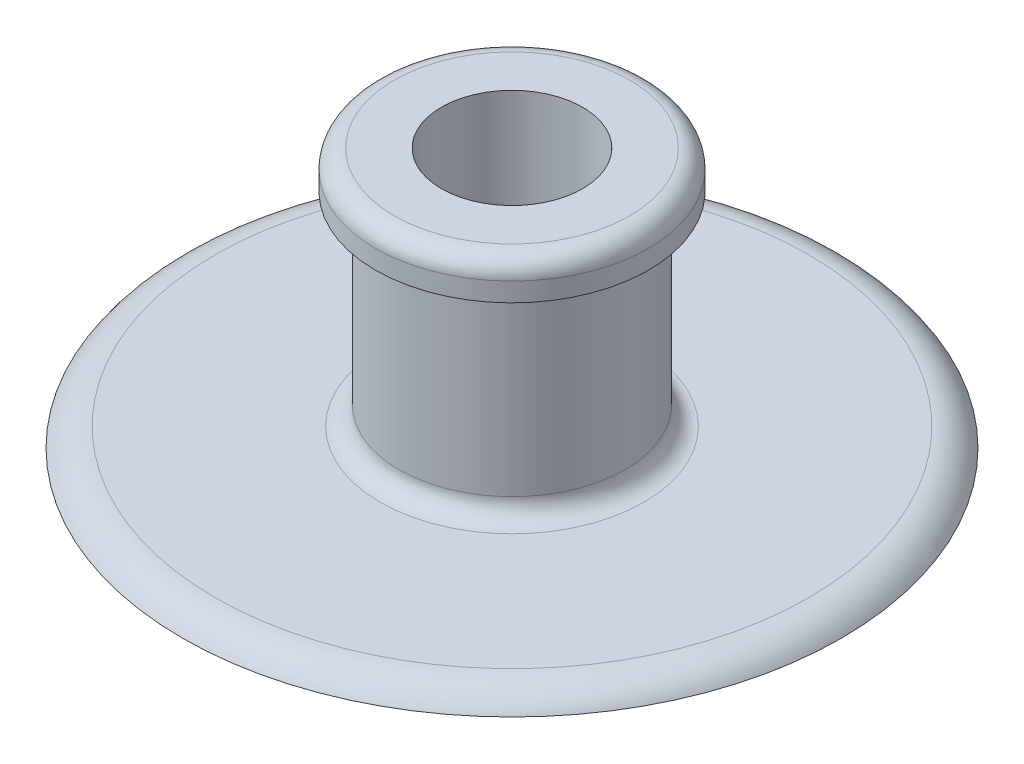
from build123d import *

# Parameters (mm, degrees)
SKETCH1_R           = 22.225
BOSS_EXTRUDE1_DEPTH = 1.27
SKETCH2_R           = 7.62
BOSS_EXTRUDE2_DEPTH = 16.256
SKETCH3_R           = 4.7625
CUT_EXTRUDE1_DEPTH  = 36.986968836
FILLET1_R           = 1.27
SKETCH4_R           = 0.508
CUT_EXTRUDE2_DEPTH  = 36.986968836
FILLET2_R           = 2.54
FILLET3_R           = 2.54
SKETCH5_W           = 1.5875
SKETCH5_H           = 2.54
FILLET4_R           = 1.27


with BuildPart() as part:
    # Sketch1 → Boss-Extrude1 (new body)
    with BuildSketch(Plane(origin=(0, 0, 0), x_dir=(1, 0, 0), z_dir=(0, 1, 0))):
        with Locations(Location((0, 0, 0), (0, 0, 270))):
            Circle(SKETCH1_R)
    extrude(amount=BOSS_EXTRUDE1_DEPTH)

    # Sketch2 → Boss-Extrude2 (add)
    with BuildSketch(Plane(origin=(0, 1.27, 0), x_dir=(1, 0, 0), z_dir=(0, 1, 0))):
        with Locations(Location((0, 0, 0), (0, 0, 270))):
            Circle(SKETCH2_R)
    extrude(amount=BOSS_EXTRUDE2_DEPTH)

    # Sketch3 → Cut-Extrude1 (cut, through all)
    with BuildSketch(Plane(origin=(0, 17.526, 0), x_dir=(1, 0, 0), z_dir=(0, 1, 0))):
        with Locations(Location((0, 0, 0), (0, 0, 270))):
            Circle(SKETCH3_R)
    extrude(amount=-CUT_EXTRUDE1_DEPTH, mode=Mode.SUBTRACT)

    # Fillet1
    fillet1_edges = [part.edges().sort_by_distance(p)[0] for p in [
        (0, 1.27, -7.62),
    ]]
    fillet(fillet1_edges, radius=FILLET1_R)

    # Sketch4 → Cut-Extrude2 (cut, through all)
    with BuildSketch(Plane(origin=(0, 0, 0), x_dir=(0, 0, -1), z_dir=(1, 0, 0))):
        with Locations((0, 2.54)):
            Circle(SKETCH4_R)
    extrude(amount=-CUT_EXTRUDE2_DEPTH, mode=Mode.SUBTRACT)

    # Fillet2
    # the kernel refuses this fillet: 2.54 mm, written as the material it takes off along each edge
    with BuildSketch(Plane(origin=(0, 1.27, 0), x_dir=(0, 0, 1), z_dir=(-1, 0, 0))) as fillet2_piece_1:
        with BuildLine():
            CenterArc((20.025295474, -2.54), FILLET2_R, 30, 60)
            Line((22.225, -1.27), (22.268994091, -1.2446))
            ThreePointArc((22.268994091, -1.2446), (22.2758, -0.635), (22.2758, 0))
            Line((22.2758, 0), (22.225, 0.0508))
            Line((22.225, 0.0508), (20.025295474, 0.0508))
            Line((20.025295474, 0.0508), (20.025295474, 0))
        make_face()
    revolve(axis=Axis((0, 1.27, 0), (0, 1, 0)), mode=Mode.SUBTRACT)

    # Fillet3
    # the kernel refuses this fillet: 2.54 mm, written as the material it takes off along each edge
    with BuildSketch(Plane(origin=(0, 0, 0), x_dir=(0, 0, 1), z_dir=(-1, 0, 0))) as fillet3_piece_1:
        with BuildLine():
            CenterArc((4.7625 + FILLET3_R, FILLET3_R), FILLET3_R, 180, 90)
            Line((4.7625, FILLET3_R), (4.7625, 0))
            Line((4.7625, 0), (4.7625 + FILLET3_R, 0))
        make_face()
    revolve(axis=Axis((0, 0, 0), (0, 1, 0)), mode=Mode.SUBTRACT)

    # Sketch5 → Revolve1 (revolve)
    with BuildSketch(Plane.XY, mode=Mode.PRIVATE) as revolve1_sk:
        with Locations((8.41375, 16.256)):
            Rectangle(SKETCH5_W, SKETCH5_H)
    revolve(revolve1_sk.sketch.rotate(Axis((0, 19.916609625, 0), (0, -1, 0)), 183.822553729), axis=Axis((0, 19.916609625, 0), (0, -1, 0)))

    # Fillet4
    fillet4_edges = [part.edges().sort_by_distance(p)[0] for p in [
        (9.187016104, 17.526, 0.613833333),
    ]]
    fillet(fillet4_edges, radius=FILLET4_R)


solid = part.part
